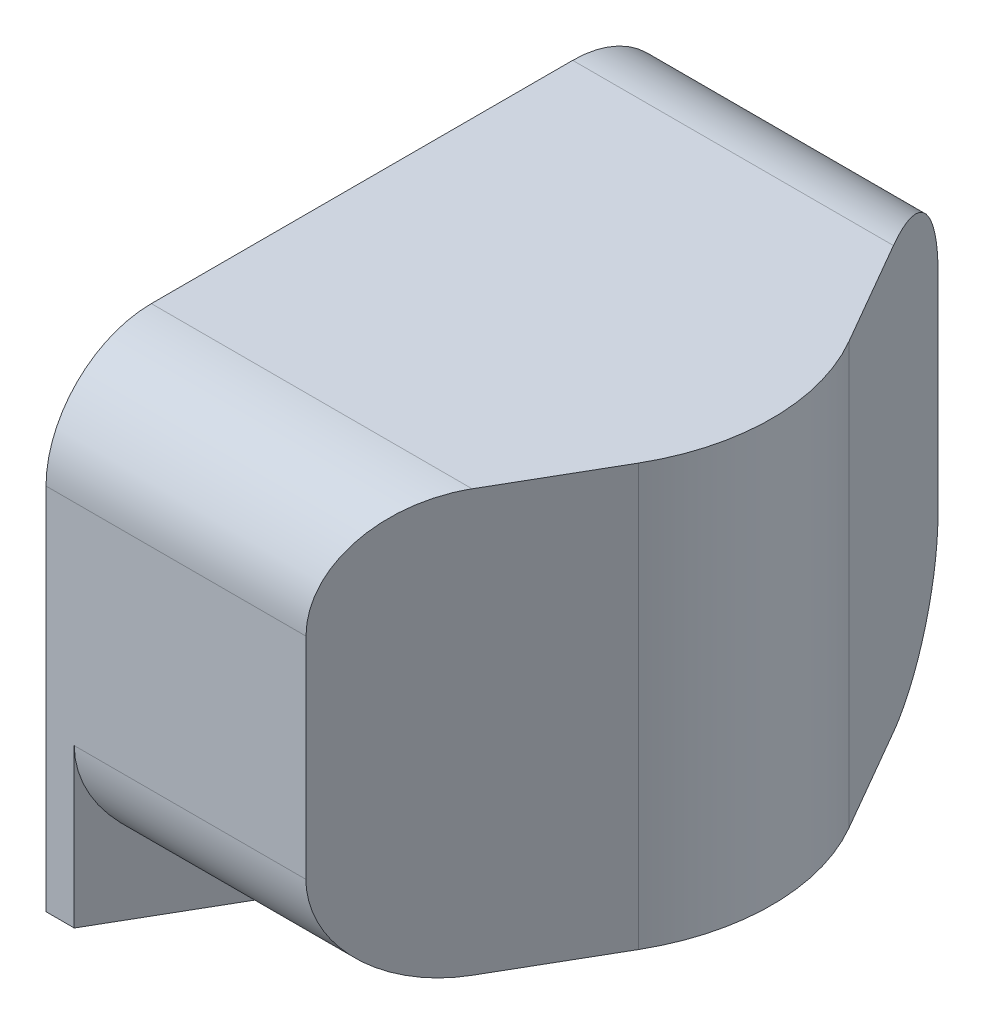
from build123d import *

# Parameters (mm, degrees)
BOSS_EXTRUDE1_START      = 23
SKETCH1_W                = 6
SKETCH1_H                = 4
BOSS_EXTRUDE1_DEPTH      = 4.2
CUT_EXTRUDE1_DEPTH       = 24.280893454
CUT_EXTRUDE1_DEPTH_BACK  = 24.280893454
BOSS_EXTRUDE3_DEPTH      = 2
BOSS_EXTRUDE3_DEPTH_BACK = 2.5
FILLET2_R                = 1


with BuildPart() as part:
    # Sketch1 → Boss-Extrude1 (new body)
    with BuildSketch(Plane(origin=(0, 0, 0), x_dir=(0, 0, -1), z_dir=(1, 0, 0)).offset(BOSS_EXTRUDE1_START)):
        Rectangle(SKETCH1_W, SKETCH1_H)
    extrude(amount=-BOSS_EXTRUDE1_DEPTH)

    # Sketch2 → Cut-Extrude1 (cut, two sides: drawn at the far end of the back side and taken through both)
    with BuildSketch(Plane(origin=(0, 0, 0), x_dir=(1, 0, 0), z_dir=(0, 1, 0)).offset(-CUT_EXTRUDE1_DEPTH_BACK)):
        with BuildLine():
            Line((11.5, 19.918584287), (22.422649731, 1))
            ThreePointArc((22.422649731, 1), (22.690598923, 0), (22.422649731, -1))
            Line((22.422649731, -1), (11.5, -19.918584287))
            Line((11.5, -19.918584287), (23, -19.918584287))
            Line((23, -19.918584287), (23, 19.918584287))
            Line((23, 19.918584287), (11.5, 19.918584287))
        make_face()
    extrude(amount=CUT_EXTRUDE1_DEPTH + CUT_EXTRUDE1_DEPTH_BACK, mode=Mode.SUBTRACT)

    # Sketch5 → Boss-Extrude3 (add, two sides: drawn at the far end of the back side and taken through both)
    with BuildSketch(Plane(origin=(0, 0, 0), x_dir=(1, 0, 0), z_dir=(0, 1, 0)).offset(-BOSS_EXTRUDE3_DEPTH_BACK)):
        Polygon((19.067949192, -3), (20.8, 0), (19.067949192, 3), (18.8, 3), (18.8, -3), align=None)
    extrude(amount=BOSS_EXTRUDE3_DEPTH + BOSS_EXTRUDE3_DEPTH_BACK)

    # Fillet2
    fillet2_edges = [part.edges().sort_by_distance(p)[0] for p in [
        (20.033974596, 2, -3),
        (20.167949192, -2, -3),
        (20.167949192, -2, 3),
        (20.033974596, 2, 3),
    ]]
    fillet(fillet2_edges, radius=FILLET2_R)


solid = part.part
